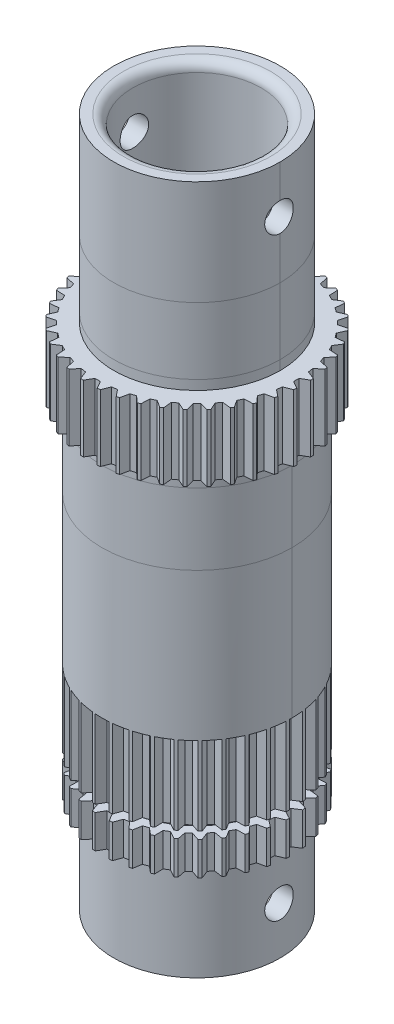
from build123d import *

# Parameters (mm, degrees)
SKETCH1_W               = 20
SKETCH1_H               = 145
SKETCH2_R               = 13.5
CUT_EXTRUDE1_DEPTH      = 148.732867027
BOSS_EXTRUDE1_START     = -14
SKETCH4_R               = 22.5
SKETCH4_R_2             = 20
BOSS_EXTRUDE1_DEPTH     = 14
CUT_EXTRUDE2_DEPTH      = 112.63108886
CIRPATTERN1_COUNT       = 40
SKETCH6_R               = 13.5
SKETCH6_R_2             = 11.5
BOSS_EXTRUDE2_DEPTH     = 103
CUT_EXTRUDE3_DEPTH      = 134.821482674
CIRPATTERN2_COUNT       = 20
FILLET1_R               = 2
SKETCH8_OUTSIDE_W       = 78.564
SKETCH8_OUTSIDE_H       = 78.564
SKETCH8_OUTSIDE_R       = 17.5
CUT_EXTRUDE4_DEPTH      = 20
CUT_EXTRUDE5_DEPTH      = 25
CIRPATTERN3_COUNT       = 35
SKETCH10_R              = 20
SKETCH10_R_2            = 16.5
CUT_EXTRUDE6_DEPTH      = 1.5
CUT_EXTRUDE7_START      = -38
SKETCH11_R              = 20
SKETCH11_R_2            = 17.5
CUT_EXTRUDE7_DEPTH      = 38
CUT_EXTRUDE8_DEPTH      = 80.148210499
CUT_EXTRUDE8_DEPTH_BACK = 80.148210499
SKETCH13_R              = 3


with BuildPart() as part:
    # Sketch1 → Revolve1 (revolve)
    with BuildSketch(Plane.XY):
        with Locations((-10, 0)):
            Rectangle(SKETCH1_W, SKETCH1_H)
    revolve(axis=Axis((0, 83.871769384, 0), (0, -1, 0)))

    # Sketch2 → Cut-Extrude1 (cut, through all)
    with BuildSketch(Plane.XZ.offset(72.5)):
        Circle(SKETCH2_R)
    extrude(amount=-CUT_EXTRUDE1_DEPTH, mode=Mode.SUBTRACT)

    # Sketch4 → Boss-Extrude1 (add)
    with BuildSketch(Plane(origin=(0, 34.5, 0), x_dir=(1, 0, 0), z_dir=(0, 1, 0)).offset(BOSS_EXTRUDE1_START)):
        Circle(SKETCH4_R)
        Circle(SKETCH4_R_2, mode=Mode.SUBTRACT)
    extrude(amount=BOSS_EXTRUDE1_DEPTH)

    # Sketch5 → Cut-Extrude2 (cut, through all)
    with BuildSketch(Plane(origin=(0, 34.5, 0), x_dir=(1, 0, 0), z_dir=(0, 1, 0))):
        with BuildLine():
            Line((0.561683849, 20.882051412), (-0.561683849, 20.882051412))
            Line((-0.561683849, 20.882051412), (-1.468123772, 22.452051412))
            ThreePointArc((-1.468123772, 22.452051412), (0, 22.5), (1.468123772, 22.452051412))
            Line((1.468123772, 22.452051412), (0.561683849, 20.882051412))
        make_face()
    cut_extrude2 = extrude(amount=-CUT_EXTRUDE2_DEPTH, mode=Mode.SUBTRACT)

    # CirPattern1: Cut-Extrude2 ×40 about axis
    cirpattern1_axis = Axis((0, 72.5, 0), (0, -1, 0))
    for i in range(1, CIRPATTERN1_COUNT):
        add(cut_extrude2.rotate(cirpattern1_axis, i * 360 / CIRPATTERN1_COUNT), mode=Mode.SUBTRACT)

    # Sketch6 → Boss-Extrude2 (add)
    with BuildSketch(Plane(origin=(0, -57.5, 0), x_dir=(-1, 0, 0), z_dir=(0, -1, 0))):
        Circle(SKETCH6_R)
        Circle(SKETCH6_R_2, mode=Mode.SUBTRACT)
    extrude(amount=-BOSS_EXTRUDE2_DEPTH)

    # Sketch7 → Cut-Extrude3 (cut, through all)
    with BuildSketch(Plane.XZ.offset(57.5)):
        with BuildLine():
            Line((1.468123772, 11.405902533), (0.561683849, 12.975902533))
            Line((0.561683849, 12.975902533), (-0.561683849, 12.975902533))
            Line((-0.561683849, 12.975902533), (-1.468123772, 11.405902533))
            ThreePointArc((-1.468123772, 11.405902533), (0, 11.5), (1.468123772, 11.405902533))
        make_face()
    cut_extrude3 = extrude(amount=-CUT_EXTRUDE3_DEPTH, mode=Mode.SUBTRACT)

    # CirPattern2: Cut-Extrude3 ×20 about axis
    cirpattern2_axis = Axis((0, -72.5, 0), (0, -1, 0))
    for i in range(1, CIRPATTERN2_COUNT):
        add(cut_extrude3.rotate(cirpattern2_axis, i * 360 / CIRPATTERN2_COUNT), mode=Mode.SUBTRACT)

    # Fillet1
    fillet1_edges = [part.edges().sort_by_distance(p)[0] for p in [
        (-13.5, 72.5, 0),
        (-13.5, -72.5, 0),
    ]]
    fillet(fillet1_edges, radius=FILLET1_R)

    # Sketch8 outside → Cut-Extrude4 (cut)
    with BuildSketch(Plane.XZ.offset(72.5)):
        Rectangle(SKETCH8_OUTSIDE_W, SKETCH8_OUTSIDE_H)
        Circle(SKETCH8_OUTSIDE_R, mode=Mode.SUBTRACT)
    extrude(amount=-CUT_EXTRUDE4_DEPTH, mode=Mode.SUBTRACT)

    # Sketch9 → Cut-Extrude5 (cut)
    with BuildSketch(Plane.XZ.offset(52.5)):
        with BuildLine():
            Line((0.566683849, 18.375673876), (1.473123772, 19.945673876))
            ThreePointArc((1.473123772, 19.945673876), (0, 20), (-1.473123772, 19.945673876))
            Line((-1.473123772, 19.945673876), (-0.566683849, 18.375673876))
            Line((-0.566683849, 18.375673876), (0.566683849, 18.375673876))
        make_face()
    cut_extrude5 = extrude(amount=-CUT_EXTRUDE5_DEPTH, mode=Mode.SUBTRACT)

    # CirPattern3: Cut-Extrude5 ×35 about axis
    cirpattern3_axis = Axis((0, -52.5, 0), (0, -1, 0))
    for i in range(1, CIRPATTERN3_COUNT):
        add(cut_extrude5.rotate(cirpattern3_axis, i * 360 / CIRPATTERN3_COUNT), mode=Mode.SUBTRACT)

    # Sketch10 → Cut-Extrude6 (cut)
    with BuildSketch(Plane(origin=(0, -45.5, 0), x_dir=(-1, 0, 0), z_dir=(0, -1, 0))):
        Circle(SKETCH10_R)
        Circle(SKETCH10_R_2, mode=Mode.SUBTRACT)
    extrude(amount=-CUT_EXTRUDE6_DEPTH, mode=Mode.SUBTRACT)

    # Sketch11 → Cut-Extrude7 (cut)
    with BuildSketch(Plane(origin=(0, 72.5, 0), x_dir=(1, 0, 0), z_dir=(0, 1, 0)).offset(CUT_EXTRUDE7_START)):
        Circle(SKETCH11_R)
        Circle(SKETCH11_R_2, mode=Mode.SUBTRACT)
    extrude(amount=CUT_EXTRUDE7_DEPTH, mode=Mode.SUBTRACT)

    # Sketch13 → Cut-Extrude8 (cut, two sides: drawn at the far end of the back side and taken through both)
    with BuildSketch(Plane(origin=(0, 0, 0), x_dir=(0, 0, -1), z_dir=(1, 0, 0)).offset(-CUT_EXTRUDE8_DEPTH_BACK)):
        with Locations((0, -62.5)):
            Circle(SKETCH13_R)
        with Locations((0, 62.5)):
            Circle(SKETCH13_R)
    extrude(amount=CUT_EXTRUDE8_DEPTH + CUT_EXTRUDE8_DEPTH_BACK, mode=Mode.SUBTRACT)


solid = part.part
